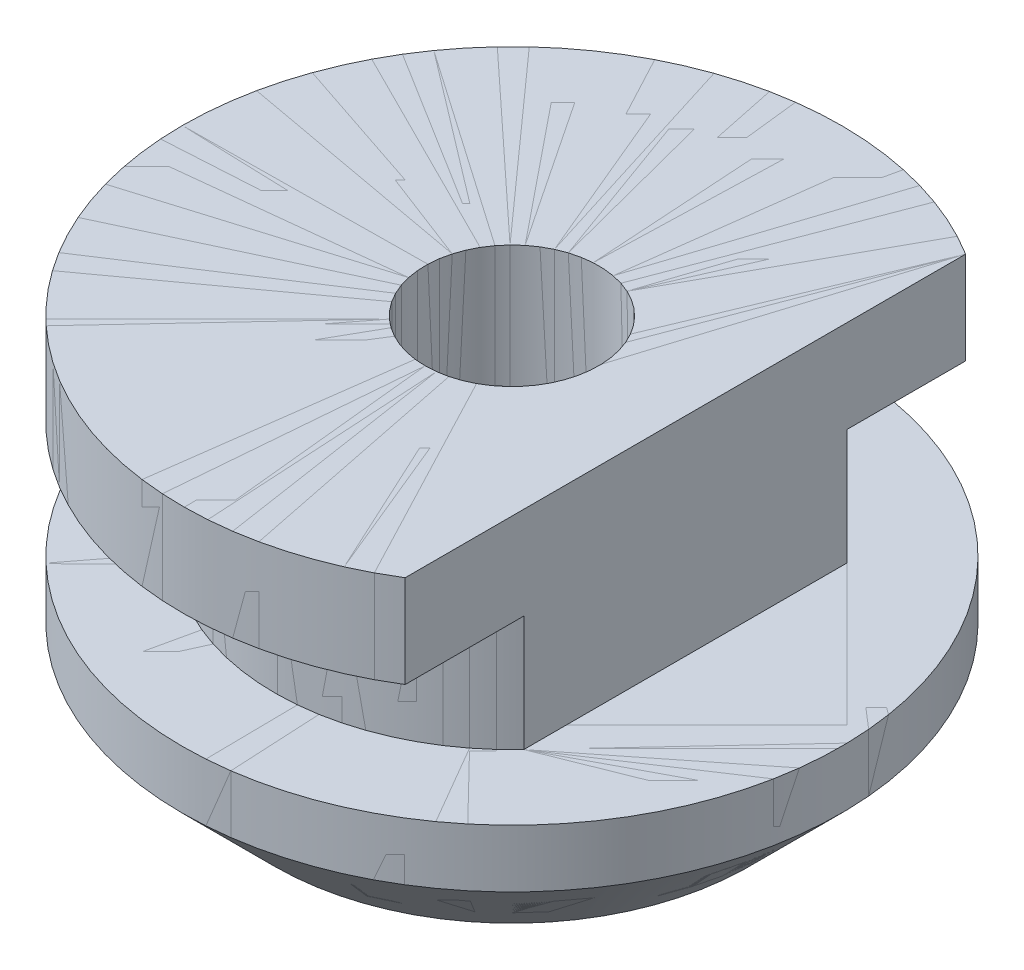
from build123d import *

# Parameters (mm, degrees)
ENL_V_MAT_EXTRU_2_DEPTH      = 54.851587997
ENL_V_MAT_EXTRU_2_DEPTH_BACK = 54.851587997
ESQUISSE4_W                  = 13.5
ESQUISSE4_H                  = 19.470096416


# Read off the part's stored shape, not the designer's step: Révolution1
with BuildPart() as part:
    # Révolution1 outline → Révolution1 (revolve)
    with BuildSketch(Plane.XY.offset(12.455129614)):
        Polygon((7.5, 20.258847156), (7.5, -0.741152844), (10.5, -10.741152844), (20.5, -10.741152844), (28.5, -2.741152844), (28.5, 2.258847156), (20.5, 2.258847156), (20.5, 12.258847156), (28.5, 12.258847156), (28.5, 20.258847156), align=None)
    revolve(axis=Axis((0, 0, 12.455129614), (0, 1, 0)))


with BuildPart() as body_2:
    # R_volution1 2 outline → R_volution1 2 (revolve)
    with BuildSketch(Plane.XY.offset(12.455129614)):
        Polygon((20.5, 12.258847156), (28.5, 12.258847156), (28.5, 20.258847156), (7.5, 20.258847156), (7.5, -0.741152844), (10.5, -10.741152844), (20.5, -10.741152844), (28.5, -2.741152844), (28.5, 2.258847156), (20.5, 2.258847156), align=None)
    revolve(axis=Axis((0, 0, 12.455129614), (0, 1, 0)))


with BuildPart() as enl_v_mat_extru_2_tool:
    # Esquisse4 → Enlèv. mat.-Extru.2 (new, two sides: drawn at the far end of the back side and taken through both)
    with BuildSketch(Plane.XY.offset(-ENL_V_MAT_EXTRU_2_DEPTH_BACK)):
        with Locations((21.75, 11.993895364)):
            Rectangle(ESQUISSE4_W, ESQUISSE4_H)
    extrude(amount=ENL_V_MAT_EXTRU_2_DEPTH + ENL_V_MAT_EXTRU_2_DEPTH_BACK)


with BuildPart() as part_1:
    add(part.part)

    # Enlèv. mat.-Extru.2: cut by enl_v_mat_extru_2_tool
    add(enl_v_mat_extru_2_tool.part, mode=Mode.SUBTRACT)


with BuildPart() as body_2_1:
    add(body_2.part)

    # Enlèv. mat.-Extru.2: cut by enl_v_mat_extru_2_tool
    add(enl_v_mat_extru_2_tool.part, mode=Mode.SUBTRACT)


solid = Compound([part_1.part, body_2_1.part])
